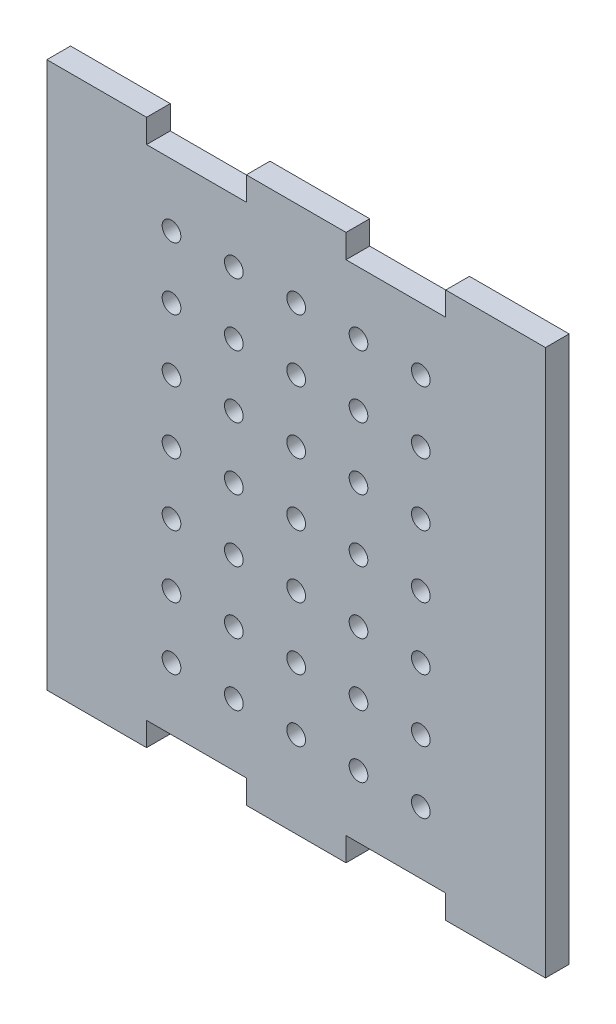
from build123d import *

# Parameters (mm, degrees)
BOSS_EXTRUDE1_DEPTH = 4.826
SKETCH2_R           = 1.905
CUT_EXTRUDE1_DEPTH  = 151.741028854


with BuildPart() as part:
    # Sketch1 → Boss-Extrude1 (new body)
    with BuildSketch(Plane.XY):
        Polygon((0, 111.252), (0, 0), (20.32, 0), (20.32, 4.826), (40.64, 4.826), (40.64, 0), (60.96, 0), (60.96, 4.826), (81.28, 4.826), (81.28, 0), (101.6, 0), (101.6, 111.252), (81.28, 111.252), (81.28, 106.426), (60.96, 106.426), (60.96, 111.252), (40.64, 111.252), (40.64, 106.426), (20.32, 106.426), (20.32, 111.252), align=None)
    extrude(amount=BOSS_EXTRUDE1_DEPTH)

    # Sketch2 → Cut-Extrude1 (cut, through all)
    with BuildSketch(Plane.XY.offset(4.826)):
        with Locations((50.8, 68.326)):
            Circle(SKETCH2_R)
        with Locations((63.5, 68.326)):
            Circle(SKETCH2_R)
        with Locations((76.2, 68.326)):
            Circle(SKETCH2_R)
        with Locations((63.5, 81.026)):
            Circle(SKETCH2_R)
        with Locations((76.2, 81.026)):
            Circle(SKETCH2_R)
        with Locations((63.5, 93.726)):
            Circle(SKETCH2_R)
        with Locations((76.2, 93.726)):
            Circle(SKETCH2_R)
        with Locations((38.1, 68.326)):
            Circle(SKETCH2_R)
        with Locations((25.4, 68.326)):
            Circle(SKETCH2_R)
        with Locations((38.1, 81.026)):
            Circle(SKETCH2_R)
        with Locations((25.4, 81.026)):
            Circle(SKETCH2_R)
        with Locations((38.1, 93.726)):
            Circle(SKETCH2_R)
        with Locations((25.4, 93.726)):
            Circle(SKETCH2_R)
        with Locations((50.8, 81.026)):
            Circle(SKETCH2_R)
        with Locations((50.8, 93.726)):
            Circle(SKETCH2_R)
        with Locations((63.5, 55.626)):
            Circle(SKETCH2_R)
        with Locations((76.2, 55.626)):
            Circle(SKETCH2_R)
        with Locations((63.5, 42.926)):
            Circle(SKETCH2_R)
        with Locations((76.2, 42.926)):
            Circle(SKETCH2_R)
        with Locations((63.5, 30.226)):
            Circle(SKETCH2_R)
        with Locations((76.2, 30.226)):
            Circle(SKETCH2_R)
        with Locations((63.5, 17.526)):
            Circle(SKETCH2_R)
        with Locations((76.2, 17.526)):
            Circle(SKETCH2_R)
        with Locations((38.1, 55.626)):
            Circle(SKETCH2_R)
        with Locations((25.4, 55.626)):
            Circle(SKETCH2_R)
        with Locations((38.1, 42.926)):
            Circle(SKETCH2_R)
        with Locations((25.4, 42.926)):
            Circle(SKETCH2_R)
        with Locations((38.1, 30.226)):
            Circle(SKETCH2_R)
        with Locations((25.4, 30.226)):
            Circle(SKETCH2_R)
        with Locations((38.1, 17.526)):
            Circle(SKETCH2_R)
        with Locations((25.4, 17.526)):
            Circle(SKETCH2_R)
        with Locations((50.8, 55.626)):
            Circle(SKETCH2_R)
        with Locations((50.8, 42.926)):
            Circle(SKETCH2_R)
        with Locations((50.8, 30.226)):
            Circle(SKETCH2_R)
        with Locations((50.8, 17.526)):
            Circle(SKETCH2_R)
    extrude(amount=-CUT_EXTRUDE1_DEPTH, mode=Mode.SUBTRACT)


solid = part.part
